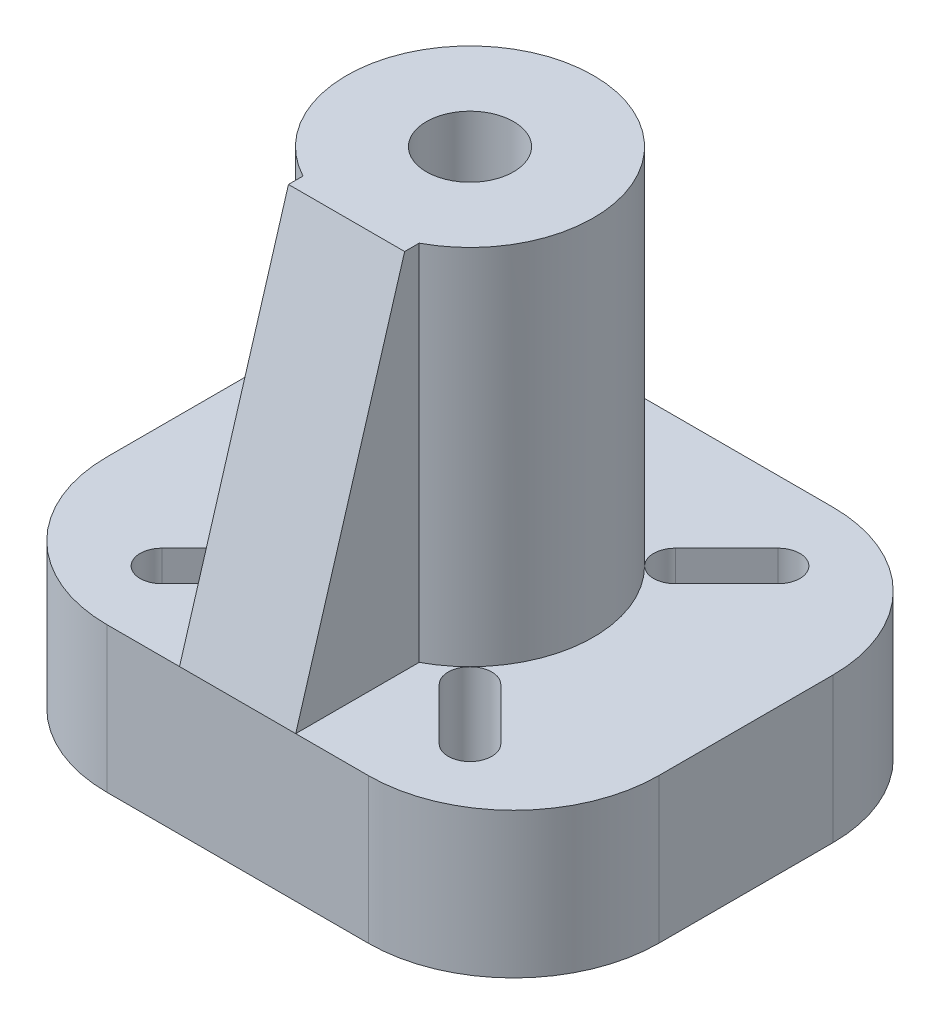
from build123d import *
from build123d.topology import SkipClean

# Parameters (mm, degrees)
SKETCH_1_R          = 5
SKETCH_1_R_2        = 1.5
EXTRUDE_2_DEPTH     = 3
CUT_EXTRUDE_START   = -37
SKETCH_2_R          = 1.5
CUT_EXTRUDE_1_DEPTH = 37
SKETCH_3_W          = 38
SKETCH_3_H          = 6.73766493
EXTRUDE_3_DEPTH     = 3
SKETCH_5_W          = 53.60328953
SKETCH_5_H          = 19.816992683
CUT_EXTRUDE_2_DEPTH = 3
SKETCH_6_W          = 38
SKETCH_6_H          = 40
EXTRUDE_5_DEPTH     = 7
SKETCH_8_W          = 38
SKETCH_8_H          = 8
CUT_EXTRUDE_4_DEPTH = 44
SKETCH_9_R          = 5
CUT_EXTRUDE_5_DEPTH = 44
CUT_EXTRUDE_6_DEPTH = 44
SKETCH_13_R         = 8.5
EXTRUDE_6_DEPTH     = 25
SKETCH_14_R         = 3
CUT_EXTRUDE_7_DEPTH = 25
EXTRUDE_7_DEPTH     = 4
FILLET_1_R          = 10


with BuildPart() as part:
    # 草图1 → 凸台-拉伸2 (new body)
    with BuildSketch(Plane(origin=(0, 0, 0), x_dir=(1, 0, 0), z_dir=(0, 1, 0))):
        with BuildLine():
            Line((0, 0), (19, 0))
            Line((19, 0), (19, 64))
            ThreePointArc((19, 64), (0, 66.760766922), (-19, 64))
            Line((-19, 64), (-19, 0))
            Line((-19, 0), (0, 0))
        make_face()
        with Locations((0, 40)):
            Circle(SKETCH_1_R, mode=Mode.SUBTRACT)
        with Locations((-16.171572875, 2.828427125)):
            Circle(SKETCH_1_R_2, mode=Mode.SUBTRACT)
        with Locations((-16.171572875, 61.171572875)):
            Circle(SKETCH_1_R_2, mode=Mode.SUBTRACT)
        with Locations((16.171572875, 61.171572875)):
            Circle(SKETCH_1_R_2, mode=Mode.SUBTRACT)
        with Locations((16.171572875, 2.828427125)):
            Circle(SKETCH_1_R_2, mode=Mode.SUBTRACT)
        with BuildLine():
            Line((10.606601718, 19.929208429), (10.606601718, 16.885025549))
            ThreePointArc((10.606601718, 16.885025549), (0, 16), (-10.606601718, 16.885025549))
            Line((-10.606601718, 16.885025549), (-10.606601718, 19.929208429))
            ThreePointArc((-10.606601718, 19.929208429), (0, 19), (10.606601718, 19.929208429))
        make_face(mode=Mode.SUBTRACT)
        with BuildLine():
            Line((-8.131727984, 46.01040764), (-11.66726189, 49.545941546))
            ThreePointArc((-11.66726189, 49.545941546), (-11.66726189, 51.66726189), (-9.545941546, 51.66726189))
            Line((-9.545941546, 51.66726189), (-6.01040764, 48.131727984))
            ThreePointArc((-6.01040764, 48.131727984), (-6.01040764, 46.01040764), (-8.131727984, 46.01040764))
        make_face(mode=Mode.SUBTRACT)
        with BuildLine():
            Line((6.01040764, 48.131727984), (9.545941546, 51.66726189))
            ThreePointArc((9.545941546, 51.66726189), (11.66726189, 51.66726189), (11.66726189, 49.545941546))
            Line((11.66726189, 49.545941546), (8.131727984, 46.01040764))
            ThreePointArc((8.131727984, 46.01040764), (6.01040764, 46.01040764), (6.01040764, 48.131727984))
        make_face(mode=Mode.SUBTRACT)
        with BuildLine():
            Line((8.131727984, 33.98959236), (11.66726189, 30.454058454))
            ThreePointArc((11.66726189, 30.454058454), (11.66726189, 28.33273811), (9.545941546, 28.33273811))
            Line((9.545941546, 28.33273811), (6.01040764, 31.868272016))
            ThreePointArc((6.01040764, 31.868272016), (6.01040764, 33.98959236), (8.131727984, 33.98959236))
        make_face(mode=Mode.SUBTRACT)
        with BuildLine():
            Line((-6.01040764, 31.868272016), (-9.545941546, 28.33273811))
            ThreePointArc((-9.545941546, 28.33273811), (-11.66726189, 28.33273811), (-11.66726189, 30.454058454))
            Line((-11.66726189, 30.454058454), (-8.131727984, 33.98959236))
            ThreePointArc((-8.131727984, 33.98959236), (-6.01040764, 33.98959236), (-6.01040764, 31.868272016))
        make_face(mode=Mode.SUBTRACT)
        with BuildLine():
            Line((-10.606601718, 60.070791571), (-10.606601718, 63.114974451))
            ThreePointArc((-10.606601718, 63.114974451), (0, 64), (10.606601718, 63.114974451))
            Line((10.606601718, 63.114974451), (10.606601718, 60.070791571))
            ThreePointArc((10.606601718, 60.070791571), (0, 61), (-10.606601718, 60.070791571))
        make_face(mode=Mode.SUBTRACT)
    extrude(amount=EXTRUDE_2_DEPTH)

    # 草图2 → 切除-拉伸1 (cut)
    with BuildSketch(Plane(origin=(0, 3, 0), x_dir=(1, 0, 0), z_dir=(0, 1, 0)).offset(CUT_EXTRUDE_START)):
        Polygon((0, 24), (-19, 24), (-19, 0), (19, 0), (19, 24), align=None)
        with Locations((-16.171572875, 2.828427125)):
            Circle(SKETCH_2_R, mode=Mode.SUBTRACT)
        with Locations((16.171572875, 2.828427125)):
            Circle(SKETCH_2_R, mode=Mode.SUBTRACT)
        with BuildLine():
            Line((-10.606601718, 16.885025549), (-10.606601718, 19.929208429))
            ThreePointArc((-10.606601718, 19.929208429), (0, 19), (10.606601718, 19.929208429))
            Line((10.606601718, 19.929208429), (10.606601718, 16.885025549))
            ThreePointArc((10.606601718, 16.885025549), (0, 16), (-10.606601718, 16.885025549))
        make_face(mode=Mode.SUBTRACT)
    extrude(amount=CUT_EXTRUDE_1_DEPTH, mode=Mode.SUBTRACT)

    # 草图3 → 凸台-拉伸3 (add)
    with BuildSketch(Plane.XZ):
        with Locations((0, -60.631167535)):
            Rectangle(SKETCH_3_W, SKETCH_3_H)
    extrude(amount=-EXTRUDE_3_DEPTH)

    # 草图5 → 切除-拉伸2 (cut)
    with BuildSketch(Plane(origin=(0, 3, 0), x_dir=(1, 0, 0), z_dir=(0, 1, 0))):
        with Locations((7.801644765, 73.908496342)):
            Rectangle(SKETCH_5_W, SKETCH_5_H)
    extrude(amount=-CUT_EXTRUDE_2_DEPTH, mode=Mode.SUBTRACT)

    # 草图6 → 凸台-拉伸5 (add)
    with BuildSketch(Plane(origin=(0, 3, 0), x_dir=(1, 0, 0), z_dir=(0, 1, 0))):
        with Locations((0, 44)):
            Rectangle(SKETCH_6_W, SKETCH_6_H)
    extrude(amount=EXTRUDE_5_DEPTH)

    # 草图8 → 切除-拉伸4 (cut)
    with BuildSketch(Plane(origin=(0, 0, 0), x_dir=(-1, 0, 0), z_dir=(0, -1, 0))):
        with Locations((0, 60)):
            Rectangle(SKETCH_8_W, SKETCH_8_H)
    extrude(amount=-CUT_EXTRUDE_4_DEPTH, mode=Mode.SUBTRACT)

    # 草图9 → 切除-拉伸5 (cut)
    with BuildSketch(Plane.XZ):
        with Locations((0, -40)):
            Circle(SKETCH_9_R)
    extrude(amount=-CUT_EXTRUDE_5_DEPTH, mode=Mode.SUBTRACT)

    # 草图11 → 切除-拉伸6 (cut)
    with BuildSketch(Plane.XZ):
        with BuildLine():
            Line((11.66726189, -30.454058454), (8.131727984, -33.98959236))
            ThreePointArc((8.131727984, -33.98959236), (6.01040764, -33.98959236), (6.01040764, -31.868272016))
            Line((6.01040764, -31.868272016), (9.545941546, -28.33273811))
            ThreePointArc((9.545941546, -28.33273811), (11.66726189, -28.33273811), (11.66726189, -30.454058454))
        make_face()
        with BuildLine():
            Line((9.545941546, -51.66726189), (6.01040764, -48.131727984))
            ThreePointArc((6.01040764, -48.131727984), (6.01040764, -46.01040764), (8.131727984, -46.01040764))
            Line((8.131727984, -46.01040764), (11.66726189, -49.545941546))
            ThreePointArc((11.66726189, -49.545941546), (11.66726189, -51.66726189), (9.545941546, -51.66726189))
        make_face()
        with BuildLine():
            Line((-11.66726189, -49.545941546), (-8.131727984, -46.01040764))
            ThreePointArc((-8.131727984, -46.01040764), (-6.01040764, -46.01040764), (-6.01040764, -48.131727984))
            Line((-6.01040764, -48.131727984), (-9.545941546, -51.66726189))
            ThreePointArc((-9.545941546, -51.66726189), (-11.66726189, -51.66726189), (-11.66726189, -49.545941546))
        make_face()
        with BuildLine():
            Line((-9.545941546, -28.33273811), (-6.01040764, -31.868272016))
            ThreePointArc((-6.01040764, -31.868272016), (-6.01040764, -33.98959236), (-8.131727984, -33.98959236))
            Line((-8.131727984, -33.98959236), (-11.66726189, -30.454058454))
            ThreePointArc((-11.66726189, -30.454058454), (-11.66726189, -28.33273811), (-9.545941546, -28.33273811))
        make_face()
    extrude(amount=-CUT_EXTRUDE_6_DEPTH, mode=Mode.SUBTRACT)

    # 草图13 → 凸台-拉伸6 (add)
    with SkipClean():  # the faces are left unmerged after this step: merging them gives an invalid solid
        with BuildSketch(Plane(origin=(0, 10, 0), x_dir=(1, 0, 0), z_dir=(0, 1, 0))):
            with Locations((0, 40)):
                Circle(SKETCH_13_R)
        extrude(amount=EXTRUDE_6_DEPTH)
    add(part.part.scale(1), mode=Mode.REPLACE)  # the faces are merged on a copy

    # 草图14 → 切除-拉伸7 (cut)
    with BuildSketch(Plane(origin=(0, 35, 0), x_dir=(1, 0, 0), z_dir=(0, 1, 0))):
        with Locations((0, 40)):
            Circle(SKETCH_14_R)
    extrude(amount=-CUT_EXTRUDE_7_DEPTH, mode=Mode.SUBTRACT)

    # 草图15 → 凸台-拉伸7 (add, symmetric)
    with BuildSketch(Plane(origin=(0, 0, 0), x_dir=(0, 0, -1), z_dir=(1, 0, 0))):
        Polygon((31.5, 35), (24, 10), (31.5, 10), (32.928568569, 10), (32.928568569, 35), align=None)
    extrude(amount=EXTRUDE_7_DEPTH, both=True)

    # 圆角1
    fillet_1_edges = [part.edges().sort_by_distance(p)[0] for p in [
        (19, 5, -24),
        (-19, 5, -24),
        (19, 5, -56),
        (-19, 5, -56),
    ]]
    fillet(fillet_1_edges, radius=FILLET_1_R)


solid = part.part
